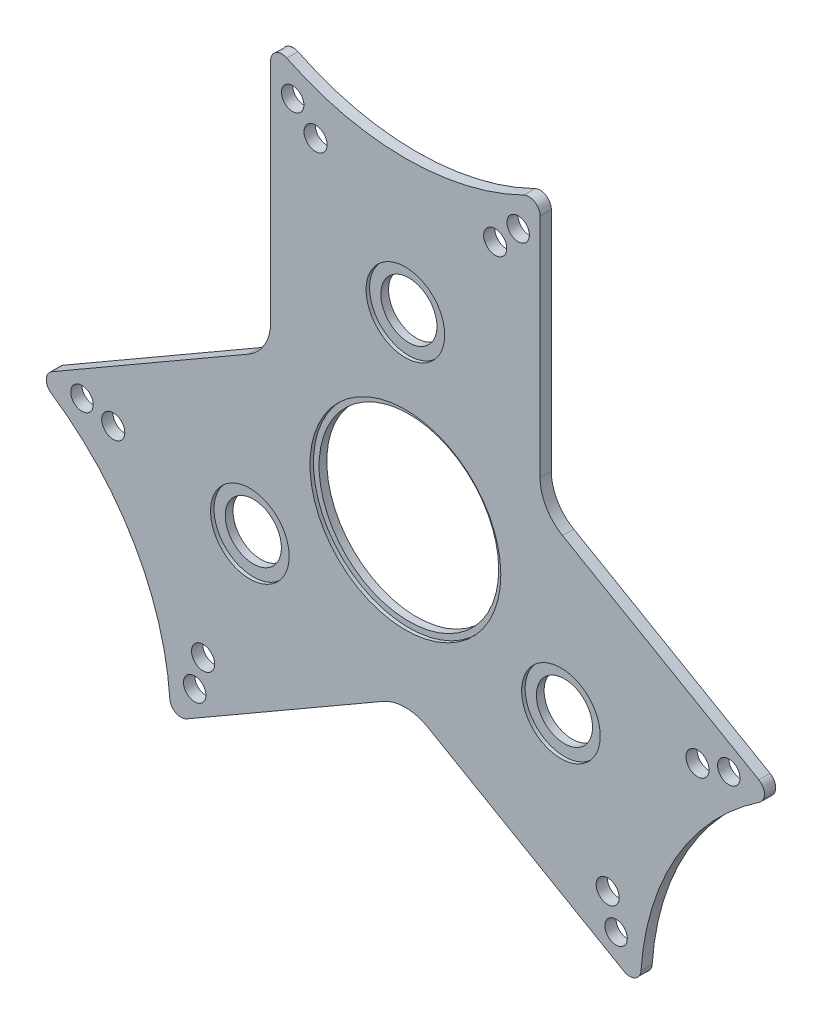
from build123d import *

# Parameters (mm, degrees)
BOSS_EXTRUDE1_DEPTH = 3.175
VARFILLET1_R        = 3.175
VARFILLET2_R        = 12.7
SKETCH5_R           = 25.4
CUT_EXTRUDE1_DEPTH  = 3.175
SKETCH5_11_R        = 26.9875
SKETCH5_11_R_2      = 25.4
CUT_EXTRUDE2_DEPTH  = 0.9906
SKETCH24_R          = 11.1125
SKETCH24_R_2        = 7.9375
CUT_EXTRUDE5_DEPTH  = 0.9906
SKETCH24_2_R        = 7.9375
CUT_EXTRUDE6_DEPTH  = 3.175
SKETCH32_R          = 3.175
SKETCH32_R_2        = 3.2639
CUT_EXTRUDE10_DEPTH = 3.175
CIRPATTERN1_COUNT   = 3


with BuildPart() as part:
    # Basic Outline → Boss-Extrude1 (new body)
    with BuildSketch(Plane.XY):
        with BuildLine():
            Line((-38.1, 98.7206881), (-38.1, 21.997045256))
            Line((-38.1, 21.997045256), (-104.544623774, -16.364776166))
            ThreePointArc((-104.544623774, -16.364776166), (-76.653488005, -44.255911934), (-66.444623774, -82.355911934))
            Line((-66.444623774, -82.355911934), (0, -43.994090512))
            Line((0, -43.994090512), (66.444623774, -82.355911934))
            ThreePointArc((66.444623774, -82.355911934), (76.653488005, -44.255911934), (104.544623774, -16.364776166))
            Line((104.544623774, -16.364776166), (38.1, 21.997045256))
            Line((38.1, 21.997045256), (38.1, 98.7206881))
            ThreePointArc((38.1, 98.7206881), (0, 88.511823868), (-38.1, 98.7206881))
        make_face()
    extrude(amount=BOSS_EXTRUDE1_DEPTH)

    # VarFillet1
    varfillet1_edges = [part.edges().sort_by_distance(p)[0] for p in [
        (-38.1, 98.7206881, 1.5875),
        (38.1, 98.7206881, 1.5875),
        (-104.544623774, -16.364776166, 1.5875),
        (-66.444623774, -82.355911934, 1.5875),
        (66.444623774, -82.355911934, 1.5875),
        (104.544623774, -16.364776166, 1.5875),
    ]]
    fillet(varfillet1_edges, radius=VARFILLET1_R)

    # VarFillet2
    varfillet2_edges = [part.edges().sort_by_distance(p)[0] for p in [
        (0, -43.994090512, 1.5875),
        (-38.1, 21.997045256, 1.5875),
        (38.1, 21.997045256, 1.5875),
    ]]
    fillet(varfillet2_edges, radius=VARFILLET2_R)

    # Sketch5 → Cut-Extrude1 (cut)
    with BuildSketch(Plane.XY.offset(3.175)):
        Circle(SKETCH5_R)
    extrude(amount=-CUT_EXTRUDE1_DEPTH, mode=Mode.SUBTRACT)

    # Sketch5<11> → Cut-Extrude2 (cut)
    with BuildSketch(Plane.XY.offset(3.175)):
        Circle(SKETCH5_11_R)
        Circle(SKETCH5_11_R_2, mode=Mode.SUBTRACT)
    extrude(amount=-CUT_EXTRUDE2_DEPTH, mode=Mode.SUBTRACT)

    # Sketch24 → Cut-Extrude5 (cut)
    # profile 1 of 3: a face of its own
    with BuildSketch(Plane.XY.offset(3.175)):
        with Locations((0, 50.8)):
            Circle(SKETCH24_R)
        with Locations((0, 50.8)):
            Circle(SKETCH24_R_2, mode=Mode.SUBTRACT)
    # profile 2 of 3: a face of its own
    with BuildSketch(Plane.XY.offset(3.175)):
        with Locations((-43.994090512, -25.4)):
            Circle(SKETCH24_R)
        with Locations((-43.994090512, -25.4)):
            Circle(SKETCH24_R_2, mode=Mode.SUBTRACT)
    # profile 3 of 3: a face of its own
    with BuildSketch(Plane.XY.offset(3.175)):
        with Locations((43.994090512, -25.4)):
            Circle(SKETCH24_R)
        with Locations((43.994090512, -25.4)):
            Circle(SKETCH24_R_2, mode=Mode.SUBTRACT)
    extrude(amount=-CUT_EXTRUDE5_DEPTH, mode=Mode.SUBTRACT)

    # Sketch24<2> → Cut-Extrude6 (cut)
    with BuildSketch(Plane.XY.offset(3.175)):
        with Locations((0, 50.8)):
            Circle(SKETCH24_2_R)
        with Locations((-43.994090512, -25.4)):
            Circle(SKETCH24_2_R)
        with Locations((43.994090512, -25.4)):
            Circle(SKETCH24_2_R)
    extrude(amount=-CUT_EXTRUDE6_DEPTH, mode=Mode.SUBTRACT)

    # Sketch32 → Cut-Extrude10 (cut)
    with BuildSketch(Plane.XY.offset(3.175)):
        with Locations((-31.877, 87.21025065)):
            Circle(SKETCH32_R)
        with Locations((-25.4, 80.73325065)):
            Circle(SKETCH32_R_2)
        with Locations((31.877, 87.21025065)):
            Circle(SKETCH32_R)
        with Locations((25.4, 80.73325065)):
            Circle(SKETCH32_R_2)
    cut_extrude10 = extrude(amount=-CUT_EXTRUDE10_DEPTH, mode=Mode.SUBTRACT)

    # CirPattern1: Cut-Extrude10 ×3 about axis
    cirpattern1_axis = Axis((0, 0, 0), (0, 0, 1))
    for i in range(1, CIRPATTERN1_COUNT):
        add(cut_extrude10.rotate(cirpattern1_axis, i * 360 / CIRPATTERN1_COUNT), mode=Mode.SUBTRACT)


solid = part.part
